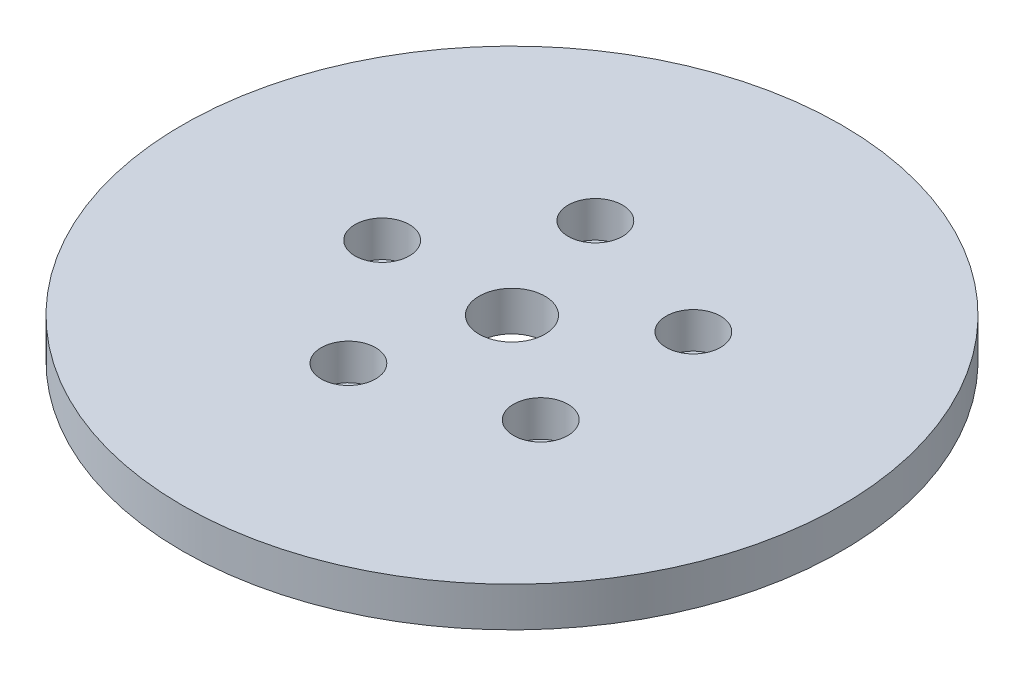
from build123d import *

# Parameters (mm, degrees)
SKETCH1_R           = 100
BOSS_EXTRUDE1_DEPTH = 12
SKETCH2_R           = 10
CUT_EXTRUDE1_DEPTH  = 142.929559994
SKETCH3_R           = 8.249182572
CUT_EXTRUDE2_DEPTH  = 10.936833745
CIRPATTERN1_COUNT   = 5


with BuildPart() as part:
    # Sketch1 → Boss-Extrude1 (new body)
    with BuildSketch(Plane(origin=(0, 0, 0), x_dir=(1, 0, 0), z_dir=(0, 1, 0))):
        Circle(SKETCH1_R)
    extrude(amount=BOSS_EXTRUDE1_DEPTH)

    # Sketch2 → Cut-Extrude1 (cut, through all)
    with BuildSketch(Plane(origin=(0, 0, 0), x_dir=(1, 0, 0), z_dir=(0, 1, 0))):
        Circle(SKETCH2_R)
    extrude(amount=CUT_EXTRUDE1_DEPTH, mode=Mode.SUBTRACT)

    # Sketch3 → Cut-Extrude2 (cut)
    with BuildSketch(Plane(origin=(0, 12, 0), x_dir=(1, 0, 0), z_dir=(0, 1, 0))):
        with Locations((-39.395319409, 0)):
            Circle(SKETCH3_R)
    cut_extrude2 = extrude(amount=-CUT_EXTRUDE2_DEPTH, mode=Mode.SUBTRACT)

    # CirPattern1: Cut-Extrude2 ×5 about axis
    cirpattern1_axis = Axis((0, 0, 0), (0, 1, 0))
    for i in range(1, CIRPATTERN1_COUNT):
        add(cut_extrude2.rotate(cirpattern1_axis, i * 360 / CIRPATTERN1_COUNT), mode=Mode.SUBTRACT)


solid = part.part
